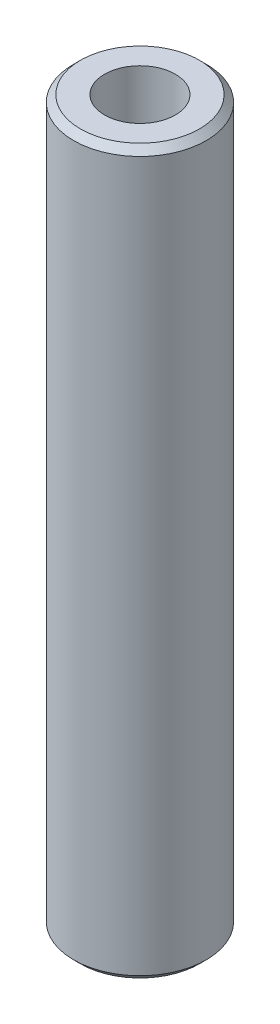
from build123d import *

# Parameters (mm, degrees)
SKETCH1_R           = 55
BOSS_EXTRUDE1_DEPTH = 600
SKETCH2_R           = 29.364825801
CUT_EXTRUDE1_DEPTH  = 606.020660804
CHAMFER1_SIZE       = 5.600006524


with BuildPart() as part:
    # Sketch1 → Boss-Extrude1 (new body)
    with BuildSketch(Plane(origin=(0, 0, 0), x_dir=(1, 0, 0), z_dir=(0, 1, 0))):
        Circle(SKETCH1_R)
    extrude(amount=BOSS_EXTRUDE1_DEPTH)

    # Sketch2 → Cut-Extrude1 (cut, through all)
    with BuildSketch(Plane(origin=(0, 0, 0), x_dir=(1, 0, 0), z_dir=(0, 1, 0))):
        Circle(SKETCH2_R)
    extrude(amount=CUT_EXTRUDE1_DEPTH, mode=Mode.SUBTRACT)

    # Chamfer1
    chamfer1_edges = [part.edges().sort_by_distance(p)[0] for p in [
        (-55, 600, 0),
        (-55, 0, 0),
    ]]
    chamfer(chamfer1_edges, length=CHAMFER1_SIZE)


solid = part.part
